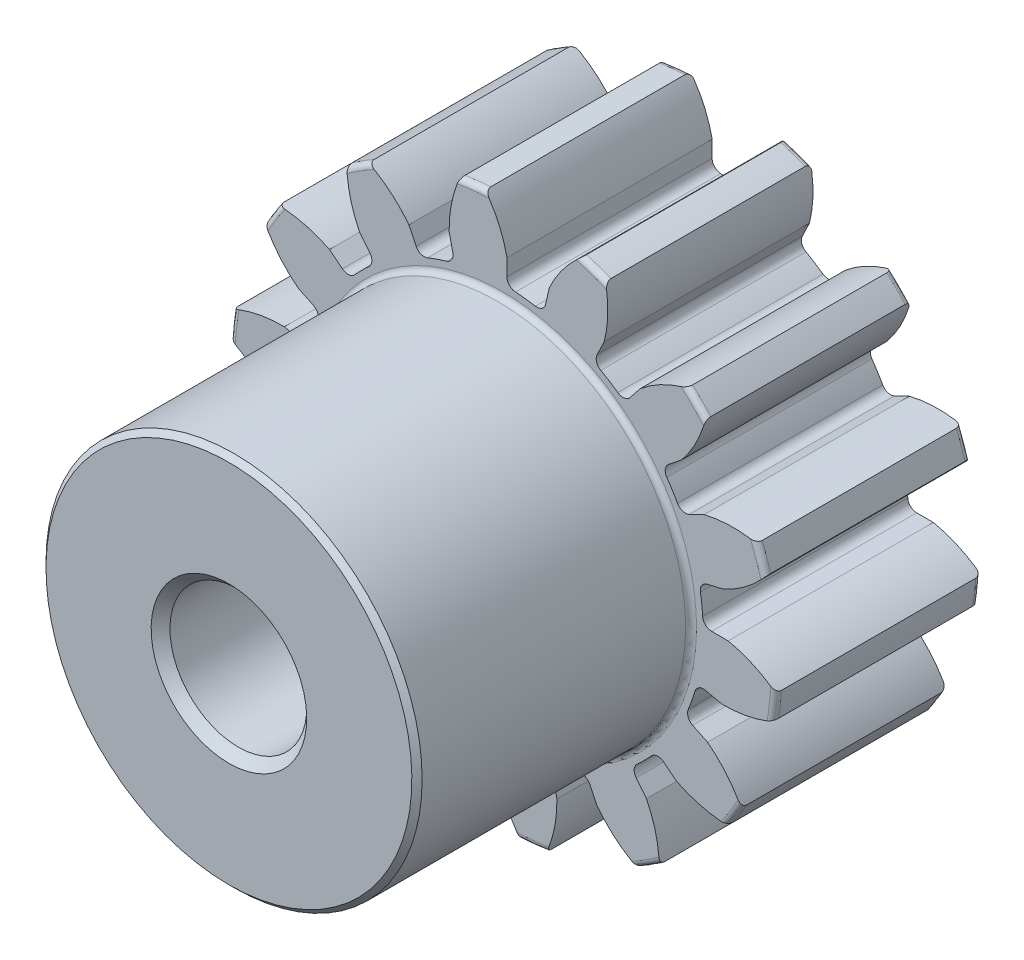
from build123d import *

# Parameters (mm, degrees)
CUT_EXTRUDE1_DEPTH       = 12.005859977
FILLET2_R                = 0.20804124
CIRPATTERN1_COUNT        = 14
FILLET2_OF_CIRPATTERN1_R = 0.20804124
BODY_MOVE_COPY1_ANGLE    = 90


with BuildPart() as part:
    # Sketch3 → Revolve1 (revolve)
    with BuildSketch(Plane.XY, mode=Mode.PRIVATE) as revolve1_sk:
        with BuildLine():
            Line((-5.5626, 1.80578125), (-5.34431875, 1.5875))
            Line((-5.34431875, 1.5875), (5.34431875, 1.5875))
            Line((5.34431875, 1.5875), (5.5626, 1.80578125))
            Line((5.5626, 1.80578125), (5.5626, 4.2465625))
            Line((5.5626, 4.2465625), (5.4435375, 4.365625))
            Line((5.4435375, 4.365625), (-0.6731, 4.365625))
            ThreePointArc((-0.6731, 4.365625), (-0.762902561, 4.402822439), (-0.8001, 4.492625))
            Line((-0.8001, 4.492625), (-0.8001, 6.223))
            ThreePointArc((-0.8001, 6.223), (-0.837297439, 6.312802561), (-0.9271, 6.35))
            Line((-0.9271, 6.35), (-5.4356, 6.35))
            ThreePointArc((-5.4356, 6.35), (-5.525402561, 6.312802561), (-5.5626, 6.223))
            Line((-5.5626, 6.223), (-5.5626, 1.80578125))
        make_face()
    revolve(revolve1_sk.sketch.rotate(Axis((-5.5626, 0, 0), (1, 0, 0)), 180), axis=Axis((-5.5626, 0, 0), (1, 0, 0)))

    # Sketch4 → Cut-Extrude1 (cut, through all)
    with BuildSketch(Plane(origin=(-0.8001, 0, 0), x_dir=(0, 0, -1), z_dir=(1, 0, 0))):
        with BuildLine():
            Line((0.092531616, 5.226315103), (0.092531616, 4.642259586))
            ThreePointArc((0.092531616, 4.642259586), (0.520964985, 4.613862986), (0.944943357, 4.546011243))
            Line((0.944943357, 4.546011243), (1.075177842, 5.115361597))
            ThreePointArc((1.075177842, 5.115361597), (1.90574303, 6.160395932), (3.125470921, 6.702797226))
            ThreePointArc((3.125470921, 6.702797226), (0.829795117, 7.348979466), (-1.552168588, 7.230963408))
            ThreePointArc((-1.552168588, 7.230963408), (-0.484096915, 6.430239864), (0.092531616, 5.226315103))
        make_face()
    cut_extrude1 = extrude(amount=-CUT_EXTRUDE1_DEPTH, mode=Mode.SUBTRACT)

    # Fillet2
    fillet2_edges = [part.edges().sort_by_distance(p)[0] for p in [
        (-3.18135, 4.546011243, -0.944943357),
        (-3.18135, 4.642259586, -0.092531616),
    ]]
    fillet(fillet2_edges, radius=FILLET2_R)

    # CirPattern1: Cut-Extrude1 ×14 about axis
    cirpattern1_axis = Axis((0, 0, 0), (1, 0, 0))
    for i in range(1, CIRPATTERN1_COUNT):
        add(cut_extrude1.rotate(cirpattern1_axis, i * 360 / CIRPATTERN1_COUNT), mode=Mode.SUBTRACT)

    # Fillet2 of CirPattern1
    fillet2_of_cirpattern1_edges = [part.edges().sort_by_distance(p)[0] for p in [
        (-3.18135, 4.50581016, 1.12107581),
        (-3.18135, 4.222679328, 1.930832842),
        (-3.18135, 3.573178114, 2.965052163),
        (-3.18135, 2.96674564, 3.571772175),
        (-3.18135, 1.932834321, 4.221763571),
        (-3.18135, 1.123211594, 4.505278225),
        (-3.18135, -0.090331014, 4.642302928),
        (-3.18135, -0.942788283, 4.546458668),
        (-3.18135, -2.095605184, 4.143377255),
        (-3.18135, -2.822057379, 3.687157213),
        (-3.18135, -3.685819046, 2.823804902),
        (-3.18135, -4.1423834, 2.097569053),
        (-3.18135, -4.546011243, 0.944943357),
        (-3.18135, -4.642259586, 0.092531616),
        (-3.18135, -4.50581016, -1.12107581),
        (-3.18135, -4.222679328, -1.930832842),
        (-3.18135, -3.573178114, -2.965052163),
        (-3.18135, -2.96674564, -3.571772175),
        (-3.18135, -1.932834321, -4.221763571),
        (-3.18135, -1.123211594, -4.505278225),
        (-3.18135, 0.090331014, -4.642302928),
        (-3.18135, 0.942788283, -4.546458668),
        (-3.18135, 2.095605184, -4.143377255),
        (-3.18135, 2.822057379, -3.687157213),
        (-3.18135, 3.685819046, -2.823804902),
        (-3.18135, 4.1423834, -2.097569053),
    ]]
    fillet(fillet2_of_cirpattern1_edges, radius=FILLET2_OF_CIRPATTERN1_R)


with BuildPart() as part_1:
    # Body-Move/Copy1: read off the stored shape, not the designer's step
    # Body-Move/Copy1: moved
    add(part.part.rotate(Axis((0, 0, 0), (0, -1, 0)), BODY_MOVE_COPY1_ANGLE))


solid = part_1.part
